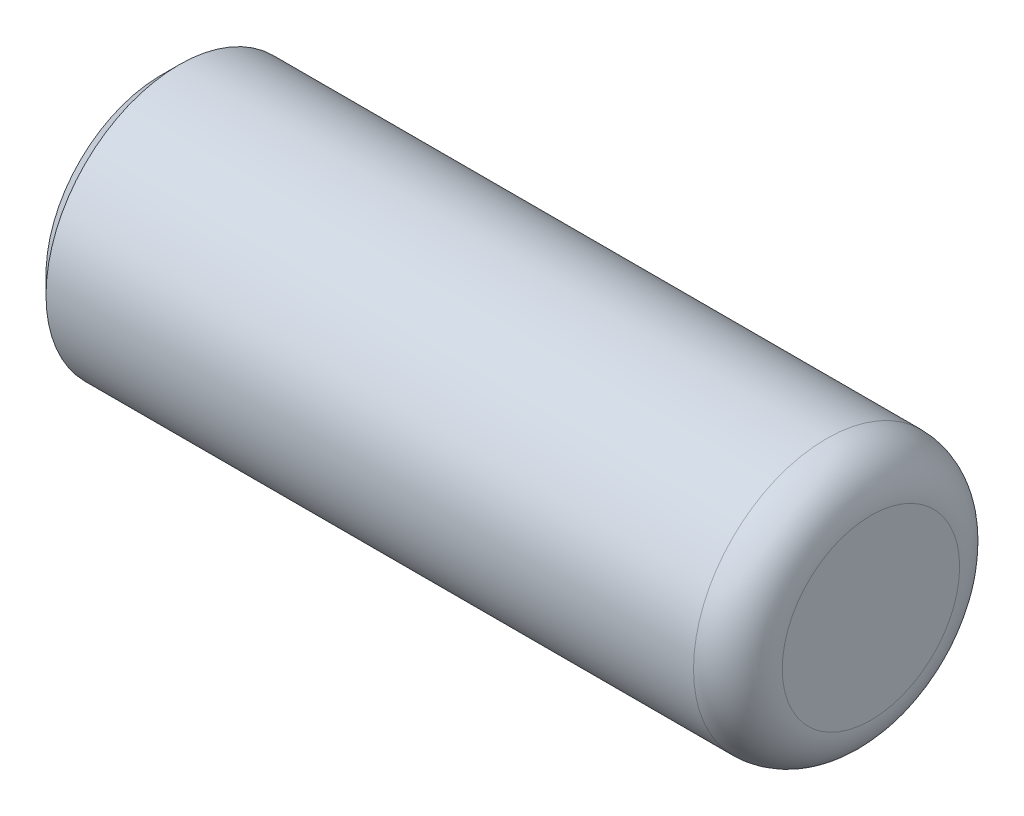
from build123d import *

# Parameters (mm, degrees)
SKETCH1_R           = 1.5
BOSS_EXTRUDE1_DEPTH = 4
FILLET1_R           = 0.5
CHAMFER1_SIZE       = 0.2


with BuildPart() as part:
    # Sketch1 → Boss-Extrude1 (new, symmetric)
    with BuildSketch(Plane(origin=(0, 0, 0), x_dir=(0, -1, 0), z_dir=(1, 0, 0))):
        Circle(SKETCH1_R)
    extrude(amount=BOSS_EXTRUDE1_DEPTH, both=True)

    # Fillet1
    fillet1_edges = [part.edges().sort_by_distance(p)[0] for p in [
        (4, 1.5, 0),
    ]]
    fillet(fillet1_edges, radius=FILLET1_R)

    # Chamfer1
    chamfer1_edges = [part.edges().sort_by_distance(p)[0] for p in [
        (-4, 1.5, 0),
    ]]
    chamfer(chamfer1_edges, length=CHAMFER1_SIZE)


solid = part.part
